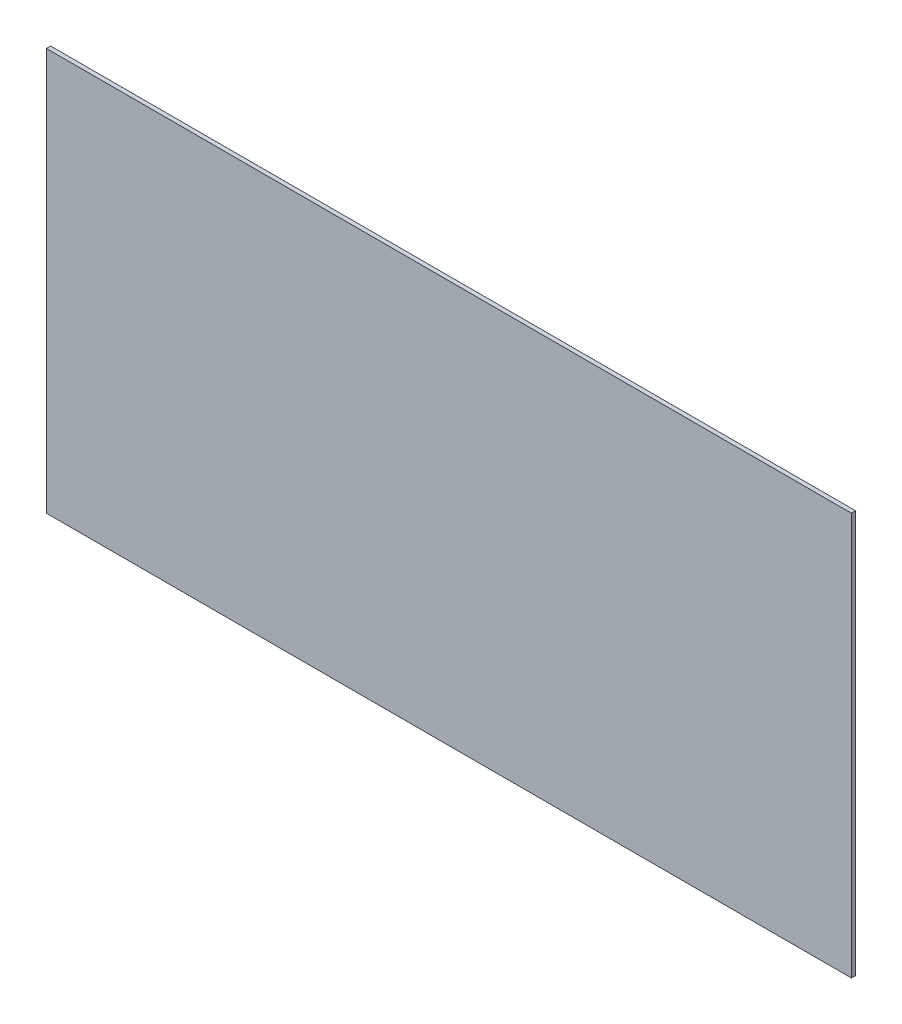
from build123d import *

# Parameters (mm, degrees)
SKETCH1_W           = 609.6
SKETCH1_H           = 304.8
BOSS_EXTRUDE1_DEPTH = 3.175


with BuildPart() as part:
    # Sketch1 → Boss-Extrude1 (new body)
    with BuildSketch(Plane.XY):
        with Locations((65.946174142, 118.622691293)):
            Rectangle(SKETCH1_W, SKETCH1_H)
    extrude(amount=BOSS_EXTRUDE1_DEPTH)


solid = part.part
